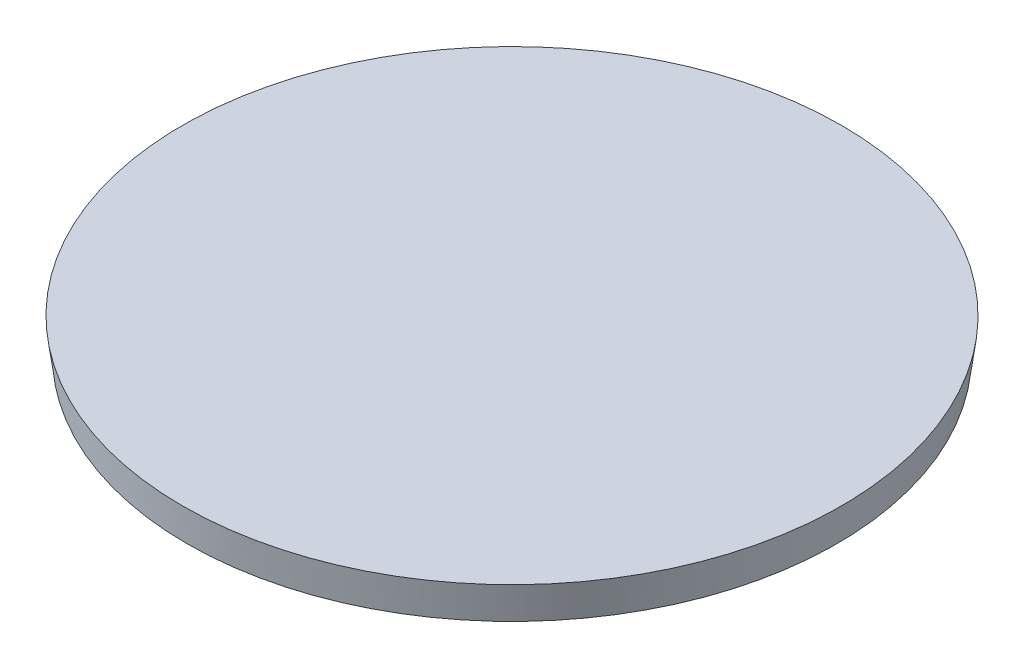
from build123d import *


with BuildPart() as part:
    # Sketch2 → Revolve1 (revolve)
    with BuildSketch(Plane.XY):
        Polygon((0, 0), (14.097, 0), (14.297638406, 1.524), (0, 1.524), align=None)
    revolve(axis=Axis((0, 1.524, 0), (0, -1, 0)))


solid = part.part
